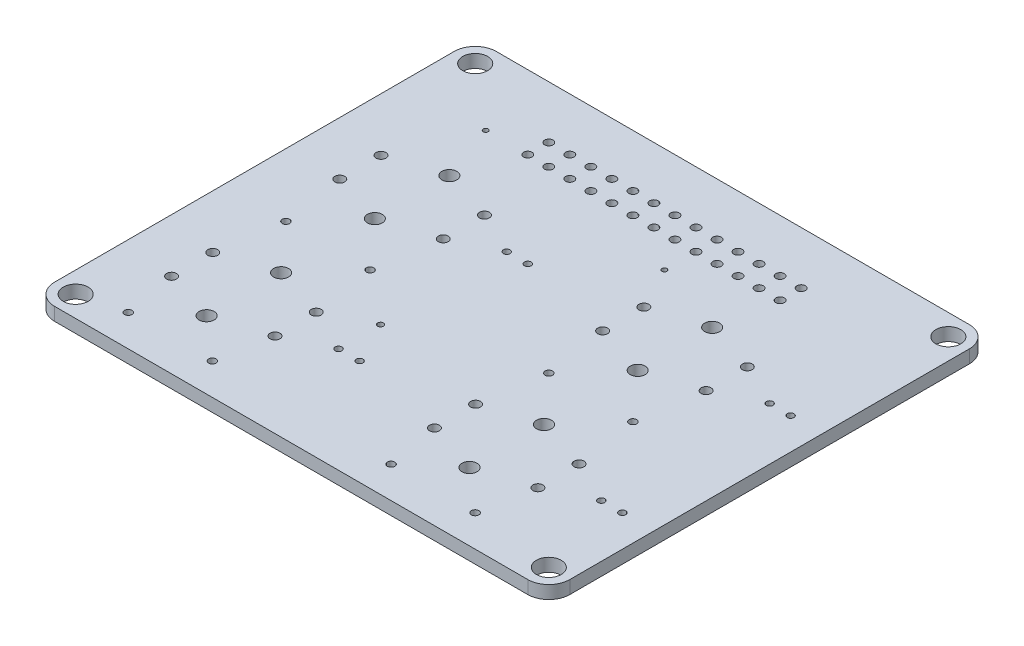
from build123d import *

# Parameters (mm, degrees)
BOSS_EXTRUDE1_DEPTH = 1.5748
SKETCH2_R           = 1.5
SKETCH2_R_2         = 0.3
SKETCH2_R_3         = 0.508
SKETCH2_R_4         = 0.5969
SKETCH2_R_5         = 0.449999989
SKETCH2_R_6         = 0.4064
SKETCH2_R_7         = 0.9017
SKETCH2_R_8         = 0.350000062
CUT_EXTRUDE1_DEPTH  = 42.011121907


with BuildPart() as part:
    # Sketch1 → Boss-Extrude1 (new body)
    with BuildSketch(Plane(origin=(0, 0, 0), x_dir=(1, 0, 0), z_dir=(0, 1, 0))):
        with BuildLine():
            Line((-28.575, 26.67), (28.575, 26.67))
            ThreePointArc((28.575, 26.67), (30.371051224, 25.926051224), (31.115, 24.13))
            Line((31.115, 24.13), (31.115, -24.13))
            ThreePointArc((31.115, -24.13), (30.371051224, -25.926051224), (28.575, -26.67))
            Line((28.575, -26.67), (-28.575, -26.67))
            ThreePointArc((-28.575, -26.67), (-30.371051224, -25.926051224), (-31.115, -24.13))
            Line((-31.115, -24.13), (-31.115, 24.13))
            ThreePointArc((-31.115, 24.13), (-30.371051224, 25.926051224), (-28.575, 26.67))
        make_face()
    extrude(amount=BOSS_EXTRUDE1_DEPTH)

    # Sketch2 → Cut-Extrude1 (cut, through all)
    with BuildSketch(Plane(origin=(0, 1.5748, 0), x_dir=(1, 0, 0), z_dir=(0, 1, 0))):
        with Locations((-28.575, 24.13)):
            Circle(SKETCH2_R)
        with Locations((28.575, 24.13)):
            Circle(SKETCH2_R)
        with Locations((28.575, -24.13)):
            Circle(SKETCH2_R)
        with Locations((-28.575, -24.13)):
            Circle(SKETCH2_R)
        with Locations((-20.955, 17.78)):
            Circle(SKETCH2_R_2)
        with Locations((14.605, 20.32)):
            Circle(SKETCH2_R_3)
        with Locations((12.065, 20.32)):
            Circle(SKETCH2_R_3)
        with Locations((9.525, 20.32)):
            Circle(SKETCH2_R_3)
        with Locations((6.985, 20.32)):
            Circle(SKETCH2_R_3)
        with Locations((4.445, 20.32)):
            Circle(SKETCH2_R_3)
        with Locations((1.905, 20.32)):
            Circle(SKETCH2_R_3)
        with Locations((-0.635, 20.32)):
            Circle(SKETCH2_R_3)
        with Locations((-3.175, 20.32)):
            Circle(SKETCH2_R_3)
        with Locations((-5.715, 20.32)):
            Circle(SKETCH2_R_3)
        with Locations((-8.255, 20.32)):
            Circle(SKETCH2_R_3)
        with Locations((-10.795, 20.32)):
            Circle(SKETCH2_R_3)
        with Locations((-13.335, 20.32)):
            Circle(SKETCH2_R_3)
        with Locations((-15.875, 20.32)):
            Circle(SKETCH2_R_3)
        with Locations((12.065, 17.78)):
            Circle(SKETCH2_R_3)
        with Locations((9.525, 17.78)):
            Circle(SKETCH2_R_3)
        with Locations((6.985, 17.78)):
            Circle(SKETCH2_R_3)
        with Locations((4.445, 17.78)):
            Circle(SKETCH2_R_3)
        with Locations((1.905, 17.78)):
            Circle(SKETCH2_R_3)
        with Locations((-0.635, 17.78)):
            Circle(SKETCH2_R_3)
        with Locations((-3.175, 17.78)):
            Circle(SKETCH2_R_3)
        with Locations((-5.715, 17.78)):
            Circle(SKETCH2_R_3)
        with Locations((-8.255, 17.78)):
            Circle(SKETCH2_R_3)
        with Locations((-10.795, 17.78)):
            Circle(SKETCH2_R_3)
        with Locations((-13.335, 17.78)):
            Circle(SKETCH2_R_3)
        with Locations((-15.875, 17.78)):
            Circle(SKETCH2_R_3)
        with Locations((14.605, 17.78)):
            Circle(SKETCH2_R_3)
        with Locations((4.445, 13.97)):
            Circle(SKETCH2_R_2)
        with Locations((-24.6634, -11.4808)):
            Circle(SKETCH2_R_4)
        with Locations((-24.6634, -16.4592)):
            Circle(SKETCH2_R_4)
        with Locations((-12.1666, -16.4592)):
            Circle(SKETCH2_R_4)
        with Locations((-12.1666, -11.4808)):
            Circle(SKETCH2_R_4)
        with Locations((-23.495, -22.86)):
            Circle(SKETCH2_R_5)
        with Locations((-13.335, -22.86)):
            Circle(SKETCH2_R_5)
        with Locations((-6.985, -13.97)):
            Circle(SKETCH2_R_6)
        with Locations((-4.445, -13.97)):
            Circle(SKETCH2_R_6)
        with Locations((-18.415, -9.4742)):
            Circle(SKETCH2_R_7)
        with Locations((-18.415, -18.47)):
            Circle(SKETCH2_R_7)
        with Locations((7.0866, -11.4808)):
            Circle(SKETCH2_R_4)
        with Locations((7.0866, -16.4592)):
            Circle(SKETCH2_R_4)
        with Locations((19.5834, -16.4592)):
            Circle(SKETCH2_R_4)
        with Locations((19.5834, -11.4808)):
            Circle(SKETCH2_R_4)
        with Locations((24.765, -13.97)):
            Circle(SKETCH2_R_6)
        with Locations((27.305, -13.97)):
            Circle(SKETCH2_R_6)
        with Locations((13.335, -9.4742)):
            Circle(SKETCH2_R_7)
        with Locations((13.335, -18.47)):
            Circle(SKETCH2_R_7)
        with Locations((7.0866, 8.8392)):
            Circle(SKETCH2_R_4)
        with Locations((7.0866, 3.8608)):
            Circle(SKETCH2_R_4)
        with Locations((19.5834, 3.8608)):
            Circle(SKETCH2_R_4)
        with Locations((19.5834, 8.8392)):
            Circle(SKETCH2_R_4)
        with Locations((24.765, 6.35)):
            Circle(SKETCH2_R_6)
        with Locations((27.305, 6.35)):
            Circle(SKETCH2_R_6)
        with Locations((13.335, 10.8458)):
            Circle(SKETCH2_R_7)
        with Locations((13.335, 1.85)):
            Circle(SKETCH2_R_7)
        with Locations((-24.6634, 8.8392)):
            Circle(SKETCH2_R_4)
        with Locations((-24.6634, 3.8608)):
            Circle(SKETCH2_R_4)
        with Locations((-12.1666, 3.8608)):
            Circle(SKETCH2_R_4)
        with Locations((-12.1666, 8.8392)):
            Circle(SKETCH2_R_4)
        with Locations((-6.985, 6.35)):
            Circle(SKETCH2_R_6)
        with Locations((-4.445, 6.35)):
            Circle(SKETCH2_R_6)
        with Locations((-18.415, 10.8458)):
            Circle(SKETCH2_R_7)
        with Locations((-18.415, 1.85)):
            Circle(SKETCH2_R_7)
        with Locations((8.255, -22.86)):
            Circle(SKETCH2_R_5)
        with Locations((18.415, -22.86)):
            Circle(SKETCH2_R_5)
        with Locations((8.255, -3.81)):
            Circle(SKETCH2_R_5)
        with Locations((18.415, -3.81)):
            Circle(SKETCH2_R_5)
        with Locations((-23.495, -3.81)):
            Circle(SKETCH2_R_5)
        with Locations((-13.335, -3.81)):
            Circle(SKETCH2_R_5)
        with Locations((-6.985, -8.89)):
            Circle(SKETCH2_R_8)
    extrude(amount=-CUT_EXTRUDE1_DEPTH, mode=Mode.SUBTRACT)


solid = part.part
